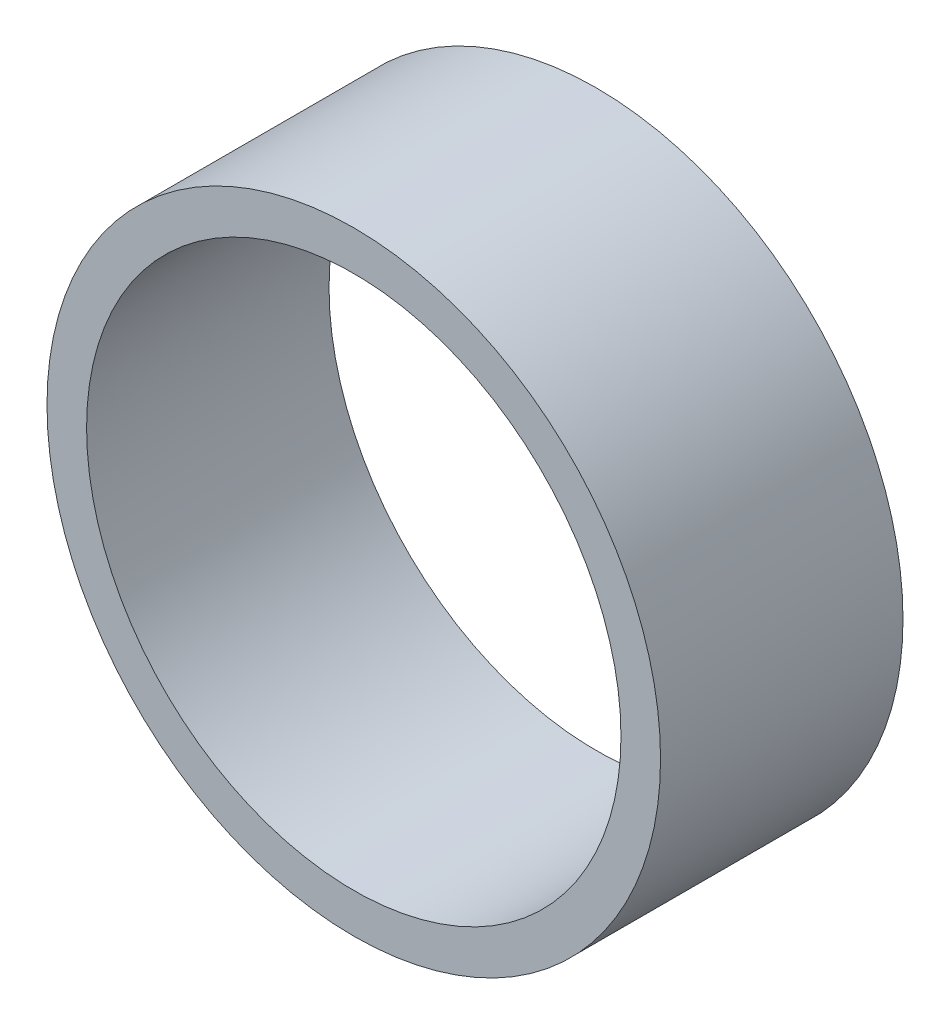
from build123d import *

# Parameters (mm, degrees)
ESQUISSE1_R        = 31
ESQUISSE1_R_2      = 27
BOSS_EXTRU_1_DEPTH = 24.5


with BuildPart() as part:
    # Esquisse1 → Boss.-Extru.1 (new body)
    with BuildSketch(Plane.XY):
        Circle(ESQUISSE1_R)
        Circle(ESQUISSE1_R_2, mode=Mode.SUBTRACT)
    extrude(amount=BOSS_EXTRU_1_DEPTH)


solid = part.part
